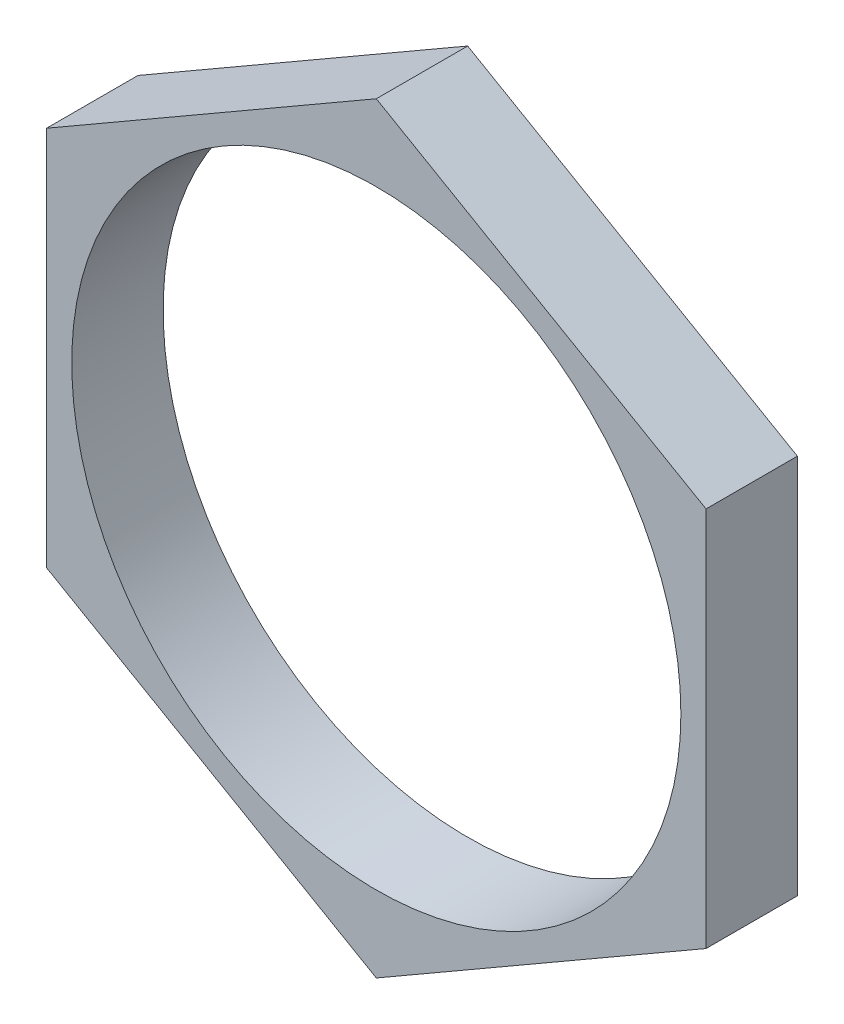
from build123d import *

# Parameters (mm, degrees)
SKETCH1_R           = 10
BOSS_EXTRUDE1_DEPTH = 3


with BuildPart() as part:
    # Sketch1 → Boss-Extrude1 (new body)
    with BuildSketch(Plane.XY):
        Polygon((10.825317547, -6.25), (10.825317547, 6.25), (0, 12.5), (-10.825317547, 6.25), (-10.825317547, -6.25), (0, -12.5), align=None)
        Circle(SKETCH1_R, mode=Mode.SUBTRACT)
    extrude(amount=BOSS_EXTRUDE1_DEPTH)


solid = part.part
